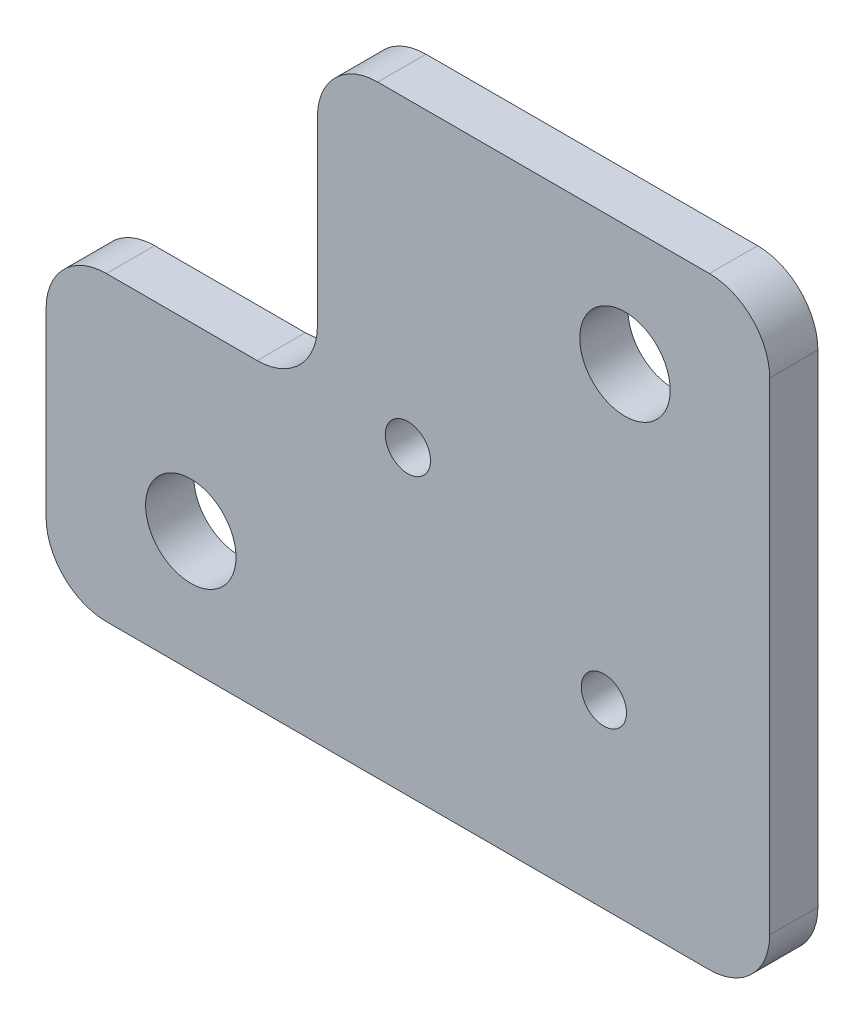
from build123d import *

# Parameters (mm, degrees)
SKETCH_1_W          = 12
SKETCH_1_H          = 10
EXTRUDE_1_DEPTH     = 0.8
CUT_EXTRUDE_1_REACH = 9.851
SKETCH_2_R          = 0.375
SKETCH_2_R_2        = 0.75
SKETCH_2_W          = 4.5
SKETCH_2_H          = 5
FILLET_1_R          = 1


with BuildPart() as part:
    # Эскиз1 → Бобышка-Вытянуть1 (new body)
    with BuildSketch(Plane.XY):
        Rectangle(SKETCH_1_W, SKETCH_1_H)
    extrude(amount=EXTRUDE_1_DEPTH)

    # Эскиз2 → Вырез-Вытянуть1 (cut, up to next)
    with BuildSketch(Plane.XY.offset(0.8), mode=Mode.PRIVATE) as cut_extrude_1_sk1:
        Circle(SKETCH_2_R)
    cut_extrude_1_tool1 = extrude(cut_extrude_1_sk1.sketch, amount=-CUT_EXTRUDE_1_REACH, mode=Mode.PRIVATE) & part.part
    # Эскиз2 → Вырез-Вытянуть1 (cut, up to next)
    with BuildSketch(Plane.XY.offset(0.8), mode=Mode.PRIVATE) as cut_extrude_1_sk2:
        with Locations((-3.6, -3)):
            Circle(SKETCH_2_R_2)
    cut_extrude_1_tool2 = extrude(cut_extrude_1_sk2.sketch, amount=-CUT_EXTRUDE_1_REACH, mode=Mode.PRIVATE) & part.part
    # Эскиз2 → Вырез-Вытянуть1 (cut, up to next)
    with BuildSketch(Plane.XY.offset(0.8), mode=Mode.PRIVATE) as cut_extrude_1_sk3:
        with Locations((3.6, 3)):
            Circle(SKETCH_2_R_2)
    cut_extrude_1_tool3 = extrude(cut_extrude_1_sk3.sketch, amount=-CUT_EXTRUDE_1_REACH, mode=Mode.PRIVATE) & part.part
    # Эскиз2 → Вырез-Вытянуть1 (cut, up to next)
    with BuildSketch(Plane.XY.offset(0.8), mode=Mode.PRIVATE) as cut_extrude_1_sk4:
        with Locations((3.25, -2)):
            Circle(SKETCH_2_R)
    cut_extrude_1_tool4 = extrude(cut_extrude_1_sk4.sketch, amount=-CUT_EXTRUDE_1_REACH, mode=Mode.PRIVATE) & part.part
    # Эскиз2 → Вырез-Вытянуть1 (cut, up to next)
    with BuildSketch(Plane.XY.offset(0.8), mode=Mode.PRIVATE) as cut_extrude_1_sk5:
        with Locations((-3.75, 2.5)):
            Rectangle(SKETCH_2_W, SKETCH_2_H)
    cut_extrude_1_tool5 = extrude(cut_extrude_1_sk5.sketch, amount=-CUT_EXTRUDE_1_REACH, mode=Mode.PRIVATE) & part.part
    add(cut_extrude_1_tool1.solids().sort_by_distance((0, 0, 0.8))[0], mode=Mode.SUBTRACT)
    add(cut_extrude_1_tool2.solids().sort_by_distance((-3.6, -3, 0.8))[0], mode=Mode.SUBTRACT)
    add(cut_extrude_1_tool3.solids().sort_by_distance((3.6, 3, 0.8))[0], mode=Mode.SUBTRACT)
    add(cut_extrude_1_tool4.solids().sort_by_distance((3.25, -2, 0.8))[0], mode=Mode.SUBTRACT)
    add(cut_extrude_1_tool5.solids().sort_by_distance((-3.75, 2.5, 0.8))[0], mode=Mode.SUBTRACT)

    # Скругление1
    fillet_1_edges = [part.edges().sort_by_distance(p)[0] for p in [
        (6, -5, 0.4),
        (-6, -5, 0.4),
        (6, 5, 0.4),
        (-1.5, 5, 0.4),
        (-1.5, 0, 0.4),
        (-6, 0, 0.4),
    ]]
    fillet(fillet_1_edges, radius=FILLET_1_R)


solid = part.part
